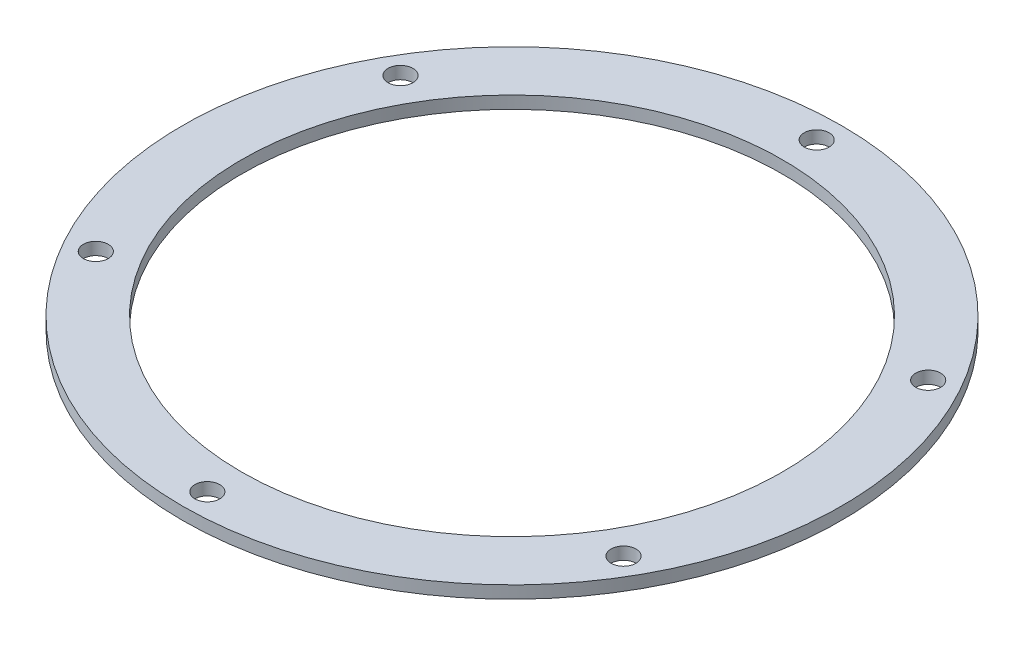
from build123d import *

# Parameters (mm, degrees)
SKETCH1_R           = 53
SKETCH1_R_2         = 43.5
SKETCH1_R_3         = 2
BOSS_EXTRUDE1_DEPTH = 2


with BuildPart() as part:
    # Sketch1 → Boss-Extrude1 (new body)
    with BuildSketch(Plane(origin=(0, 0, 0), x_dir=(1, 0, 0), z_dir=(0, 1, 0))):
        Circle(SKETCH1_R)
        Circle(SKETCH1_R_2, mode=Mode.SUBTRACT)
        with Locations((0, 49)):
            Circle(SKETCH1_R_3, mode=Mode.SUBTRACT)
        with Locations((42.435244785, 24.5)):
            Circle(SKETCH1_R_3, mode=Mode.SUBTRACT)
        with Locations((42.435244785, -24.5)):
            Circle(SKETCH1_R_3, mode=Mode.SUBTRACT)
        with Locations((0, -49)):
            Circle(SKETCH1_R_3, mode=Mode.SUBTRACT)
        with Locations((-42.435244785, -24.5)):
            Circle(SKETCH1_R_3, mode=Mode.SUBTRACT)
        with Locations((-42.435244785, 24.5)):
            Circle(SKETCH1_R_3, mode=Mode.SUBTRACT)
    extrude(amount=BOSS_EXTRUDE1_DEPTH)


solid = part.part
